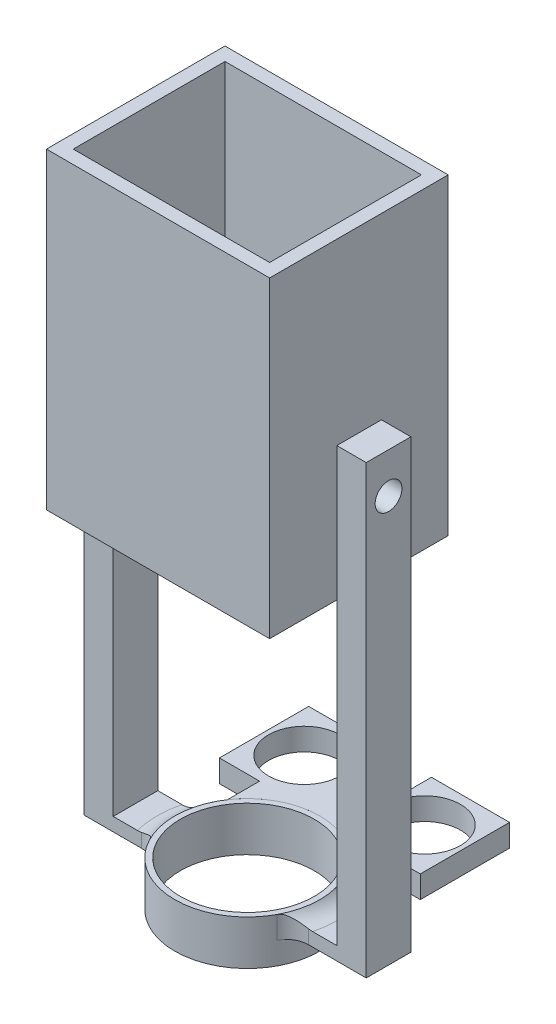
from build123d import *

# Parameters (mm, degrees)
CONNECTOR_SLEEVE_DEPTH        = 5
CONNECTOR_SLEEVE_DEPTH_BACK   = 5
SKETCH3_W                     = 50
SKETCH3_H                     = 40
SKETCH3_R                     = 3
MOTOR_CASING_DEPTH            = 70
SHELL4_T                      = -3
SKETCH6_R                     = 16
SKETCH6_R_2                   = 15
MOTOR_SITS_HERE_DEPTH         = 30
SKETCH2_16_W                  = 6.592135624
SKETCH2_16_H                  = 10
SLEEVE_CASING_CONNECTOR_DEPTH = 3
SKETCH2_17_W                  = 6.592135624
SKETCH2_17_H                  = 10
SLEEVE_CASING_ARMS_DEPTH      = 100
SKETCH2_10_R                  = 8
SENSOR_HOLDER_DEPTH           = 5
FILLET2_R                     = 5
CUT_EXTRUDE5_DEPTH            = 124.769792437
CUT_EXTRUDE5_DEPTH_BACK       = 124.769792437
SKETCH8_R                     = 3


with BuildPart() as part:
    # Sketch2 → Connector sleeve (new, two sides: drawn at the far end of the back side and taken through both)
    with BuildSketch(Plane(origin=(0, 0, 0), x_dir=(1, 0, 0), z_dir=(0, 1, 0)).offset(-CONNECTOR_SLEEVE_DEPTH_BACK)):
        with BuildLine():
            Line((-14.142135624, -5), (-15.461646096, -5))
            ThreePointArc((-15.461646096, -5), (0, -16.25), (15.461646096, -5))
            Line((15.461646096, -5), (14.142135624, -5))
            ThreePointArc((14.142135624, -5), (0, -15), (-14.142135624, -5))
        make_face()
        with BuildLine():
            ThreePointArc((-13.5, 9.045026258), (-14.62138145, 7.090677295), (-15.461646096, 5))
            Line((-15.461646096, 5), (-14.142135624, 5))
            ThreePointArc((-14.142135624, 5), (0, 15), (14.142135624, 5))
            Line((14.142135624, 5), (15.461646096, 5))
            ThreePointArc((15.461646096, 5), (14.62138145, 7.090677295), (13.5, 9.045026258))
            ThreePointArc((13.5, 9.045026258), (7.651170607, 14.336041586), (0, 16.25))
            ThreePointArc((0, 16.25), (-7.651170607, 14.336041586), (-13.5, 9.045026258))
        make_face()
        with BuildLine():
            Line((15.461646096, 5), (14.142135624, 5))
            ThreePointArc((14.142135624, 5), (14.783978395, 2.536529681), (15, 0))
            ThreePointArc((15, 0), (14.783978395, -2.536529681), (14.142135624, -5))
            Line((14.142135624, -5), (15.461646096, -5))
            ThreePointArc((15.461646096, -5), (16.051701609, -2.530884326), (16.25, 0))
            ThreePointArc((16.25, 0), (16.051701609, 2.530884326), (15.461646096, 5))
        make_face()
        with BuildLine():
            Line((-14.142135624, 5), (-15.461646096, 5))
            ThreePointArc((-15.461646096, 5), (-16.25, 0), (-15.461646096, -5))
            Line((-15.461646096, -5), (-14.142135624, -5))
            ThreePointArc((-14.142135624, -5), (-15, 0), (-14.142135624, 5))
        make_face()
    extrude(amount=CONNECTOR_SLEEVE_DEPTH + CONNECTOR_SLEEVE_DEPTH_BACK)

    # Sketch2<16> → Sleeve-casing connector (add)
    with BuildSketch(Plane(origin=(0, 0, 0), x_dir=(1, 0, 0), z_dir=(0, 1, 0))):
        with BuildLine():
            Line((-15.461646096, 5), (-25.05, 5))
            Line((-25.05, 5), (-25.05, -5))
            Line((-25.05, -5), (-15.461646096, -5))
            ThreePointArc((-15.461646096, -5), (-16.25, 0), (-15.461646096, 5))
        make_face()
        with Locations((-28.346067812, 0)):
            Rectangle(SKETCH2_16_W, SKETCH2_16_H)
        with BuildLine():
            ThreePointArc((16.25, 0), (16.051701609, -2.530884326), (15.461646096, -5))
            Line((15.461646096, -5), (25.05, -5))
            Line((25.05, -5), (25.05, 5))
            Line((25.05, 5), (15.461646096, 5))
            ThreePointArc((15.461646096, 5), (16.051701609, 2.530884326), (16.25, 0))
        make_face()
        with Locations((28.346067812, 0)):
            Rectangle(SKETCH2_16_W, SKETCH2_16_H)
    extrude(amount=SLEEVE_CASING_CONNECTOR_DEPTH)

    # Sketch2<17> → Sleeve-casing arms (add)
    with BuildSketch(Plane(origin=(0, 0, 0), x_dir=(1, 0, 0), z_dir=(0, 1, 0))):
        with Locations((-28.346067812, 0)):
            Rectangle(SKETCH2_17_W, SKETCH2_17_H)
        with Locations((28.346067812, 0)):
            Rectangle(SKETCH2_17_W, SKETCH2_17_H)
    extrude(amount=SLEEVE_CASING_ARMS_DEPTH)

    # Fillet2
    # the kernel refuses this fillet: 5 mm, written as the material it adds along each edge
    with BuildSketch(Plane(origin=(0, 3, 0), x_dir=(-0.5992835092298462, 0, 0.8005368670868074), z_dir=(0.8005368670868074, 0, 0.5992835092298462))) as fillet2_piece_1_section:
        with BuildLine():
            CenterArc((20.25, -5), FILLET2_R, 90, 53.130102354)
            Line((20.25, 0), (20.25, 0.1))
            Line((20.25, 0.1), (16.25, 0.1))
            Line((16.25, 0.1), (16.15, 0))
            ThreePointArc((16.15, 0), (16.15, -1), (16.17, -1.94))
            Line((16.17, -1.94), (16.25, -2))
        make_face()
    fillet2_piece_1 = revolve(axis=Axis((0, 3, 0), (0, -1, 0)), revolution_arc=106.362800019, mode=Mode.PRIVATE)
    fillet2_piece_1 = split(fillet2_piece_1, bisect_by=Plane(origin=(-17.030163823, 3.512375165, -5), z_dir=(0, 0, 1)), keep=Keep.TOP, mode=Mode.PRIVATE)
    fillet2_piece_1 = split(fillet2_piece_1, bisect_by=Plane(origin=(-17.030163823, 3.512375165, 5), z_dir=(0, 0, -1)), keep=Keep.TOP, mode=Mode.PRIVATE)
    add(fillet2_piece_1)
    with BuildSketch(Plane(origin=(-15.461646096, 0, 5), x_dir=(0.3906724879832055, 0, 0.9205297426661521), z_dir=(0, 1, 0)), Plane(origin=(15.461646096, 0, -5), x_dir=(-0.39067248798317566, 0, -0.9205297426661648), z_dir=(0, 1, 0))) as fillet2_piece_2:
        with BuildLine():
            CenterArc((3.317979312, -4.980390013), FILLET2_R, 95.076136898, 61.927513064)
            Line((-1.284669401, -3.027027573), (-1.376722375, -2.987960324))
            Line((-1.376722375, -2.987960324), (-0.092052974, 0.039067249))
            Line((-0.092052974, 0.039067249), (0.008847945, 0.0996078))
            ThreePointArc((0.008847945, 0.0996078), (1.437791035, 0.036267542), (2.866734126, 0.0996078))
            Line((2.866734126, 0.0996078), (2.875582071, 0))
        make_face()
    extrude(amount=3)
    with BuildSketch(Plane(origin=(-15.461646096, 0, -5), x_dir=(0.3906724879831855, 0, -0.9205297426661605), z_dir=(0, 1, 0)), Plane(origin=(15.461646096, 0, 5), x_dir=(-0.3906724879831673, 0, 0.9205297426661683), z_dir=(0, 1, 0))) as fillet2_piece_3:
        with BuildLine():
            CenterArc((3.317979312, 4.980390013), FILLET2_R, 202.996350038, 61.927513064)
            Line((-1.284669401, 3.027027573), (-1.376722375, 2.987960324))
            Line((-1.376722375, 2.987960324), (-0.092052974, -0.039067249))
            Line((-0.092052974, -0.039067249), (0.008847945, -0.0996078))
            ThreePointArc((0.008847945, -0.0996078), (1.437791035, -0.036267542), (2.866734126, -0.0996078))
            Line((2.866734126, -0.0996078), (2.875582071, 0))
        make_face()
    extrude(amount=3)
    with BuildSketch(Plane(origin=(0, 3, 0), x_dir=(0.5992835092298779, 0, 0.8005368670867836), z_dir=(-0.8005368670867836, 0, 0.5992835092298779))) as fillet2_piece_4_section:
        with BuildLine():
            CenterArc((20.25, 5), FILLET2_R, 216.869897646, 53.130102354)
            Line((20.25, 0), (20.25, -0.1))
            Line((20.25, -0.1), (16.25, -0.1))
            Line((16.25, -0.1), (16.15, 0))
            ThreePointArc((16.15, 0), (16.15, 1), (16.17, 1.94))
            Line((16.17, 1.94), (16.25, 2))
        make_face()
    fillet2_piece_4 = revolve(axis=Axis((0, 3, 0), (0, 1, 0)), revolution_arc=106.362800019, mode=Mode.PRIVATE)
    fillet2_piece_4 = split(fillet2_piece_4, bisect_by=Plane(origin=(17.030163823, 3.512375165, 5), z_dir=(0, 0, -1)), keep=Keep.TOP, mode=Mode.PRIVATE)
    fillet2_piece_4 = split(fillet2_piece_4, bisect_by=Plane(origin=(17.030163823, 3.512375165, -5), z_dir=(0, 0, 1)), keep=Keep.TOP, mode=Mode.PRIVATE)
    add(fillet2_piece_4)
    with BuildSketch(Plane(origin=(0, 3, 0), x_dir=(-0.5992835092298462, 0, 0.8005368670868074), z_dir=(0.8005368670868074, 0, 0.5992835092298462))) as fillet2_piece_5a_section:
        with BuildLine():
            CenterArc((20.25, -5), FILLET2_R, 90, 53.130102354)
            Line((20.25, 0), (20.25, 0.1))
            Line((20.25, 0.1), (16.25, 0.1))
            Line((16.25, 0.1), (16.15, 0))
            ThreePointArc((16.15, 0), (16.15, -1), (16.17, -1.94))
            Line((16.17, -1.94), (16.25, -2))
        make_face()
    fillet2_piece_5a = revolve(axis=Axis((0, 3, 0), (0, -1, 0)), revolution_arc=106.362800019, mode=Mode.PRIVATE)
    fillet2_piece_5a = split(fillet2_piece_5a, bisect_by=Plane(origin=(-13.980724367, 3.489518258, 5), z_dir=(0, 0, 1)), keep=Keep.TOP, mode=Mode.PRIVATE)
    with BuildSketch(Plane(origin=(-15.461646096, 0, 5), x_dir=(0.3906724879832055, 0, 0.9205297426661521), z_dir=(0, 1, 0))) as fillet2_piece_5b_section:
        with BuildLine():
            CenterArc((3.317979312, -4.980390013), FILLET2_R, 95.076136898, 61.927513064)
            Line((-1.284669401, -3.027027573), (-1.376722375, -2.987960324))
            Line((-1.376722375, -2.987960324), (-0.092052974, 0.039067249))
            Line((-0.092052974, 0.039067249), (0.008847945, 0.0996078))
            ThreePointArc((0.008847945, 0.0996078), (1.437791035, 0.036267542), (2.866734126, 0.0996078))
            Line((2.866734126, 0.0996078), (2.875582071, 0))
        make_face()
    fillet2_piece_5b = extrude(amount=11.22088476, mode=Mode.PRIVATE)
    fillet2_piece_5b = split(fillet2_piece_5b, bisect_by=Plane(origin=(-15.995215442, 5, 5.576522303), z_dir=(0, -1, 0)), keep=Keep.TOP, mode=Mode.PRIVATE)
    fillet2_piece_5b = split(fillet2_piece_5b, bisect_by=Plane(origin=(-15.995215442, 3, 5.576522303), z_dir=(0, 1, 0)), keep=Keep.TOP, mode=Mode.PRIVATE)
    fillet2_piece_5 = fillet2_piece_5a & fillet2_piece_5b
    add(fillet2_piece_5)
    with BuildSketch(Plane(origin=(-15.461646096, 0, -5), x_dir=(0.3906724879831855, 0, -0.9205297426661605), z_dir=(0, 1, 0))) as fillet2_piece_6a_section:
        with BuildLine():
            CenterArc((3.317979312, 4.980390013), FILLET2_R, 202.996350038, 61.927513064)
            Line((-1.284669401, 3.027027573), (-1.376722375, 2.987960324))
            Line((-1.376722375, 2.987960324), (-0.092052974, -0.039067249))
            Line((-0.092052974, -0.039067249), (0.008847945, -0.0996078))
            ThreePointArc((0.008847945, -0.0996078), (1.437791035, -0.036267542), (2.866734126, -0.0996078))
            Line((2.866734126, -0.0996078), (2.875582071, 0))
        make_face()
    fillet2_piece_6a = extrude(amount=11.22088476, mode=Mode.PRIVATE)
    fillet2_piece_6a = split(fillet2_piece_6a, bisect_by=Plane(origin=(-15.995215442, 5, -5.576522303), z_dir=(0, -1, 0)), keep=Keep.TOP, mode=Mode.PRIVATE)
    fillet2_piece_6a = split(fillet2_piece_6a, bisect_by=Plane(origin=(-15.995215442, 3, -5.576522303), z_dir=(0, 1, 0)), keep=Keep.TOP, mode=Mode.PRIVATE)
    with BuildSketch(Plane(origin=(0, 3, 0), x_dir=(-0.5992835092298462, 0, 0.8005368670868074), z_dir=(0.8005368670868074, 0, 0.5992835092298462))) as fillet2_piece_6b_section:
        with BuildLine():
            CenterArc((20.25, -5), FILLET2_R, 90, 53.130102354)
            Line((20.25, 0), (20.25, 0.1))
            Line((20.25, 0.1), (16.25, 0.1))
            Line((16.25, 0.1), (16.15, 0))
            ThreePointArc((16.15, 0), (16.15, -1), (16.17, -1.94))
            Line((16.17, -1.94), (16.25, -2))
        make_face()
    fillet2_piece_6b = revolve(axis=Axis((0, 3, 0), (0, -1, 0)), revolution_arc=106.362800019, mode=Mode.PRIVATE)
    fillet2_piece_6b = split(fillet2_piece_6b, bisect_by=Plane(origin=(-13.980724067, 3.489518328, -5), z_dir=(0, 0, -1)), keep=Keep.TOP, mode=Mode.PRIVATE)
    fillet2_piece_6 = fillet2_piece_6a & fillet2_piece_6b
    add(fillet2_piece_6)
    with BuildSketch(Plane(origin=(15.461646096, 0, 5), x_dir=(-0.3906724879831673, 0, 0.9205297426661683), z_dir=(0, 1, 0))) as fillet2_piece_7a_section:
        with BuildLine():
            CenterArc((3.317979312, 4.980390013), FILLET2_R, 202.996350038, 61.927513064)
            Line((-1.284669401, 3.027027573), (-1.376722375, 2.987960324))
            Line((-1.376722375, 2.987960324), (-0.092052974, -0.039067249))
            Line((-0.092052974, -0.039067249), (0.008847945, -0.0996078))
            ThreePointArc((0.008847945, -0.0996078), (1.437791035, -0.036267542), (2.866734126, -0.0996078))
            Line((2.866734126, -0.0996078), (2.875582071, 0))
        make_face()
    fillet2_piece_7a = extrude(amount=11.22088476, mode=Mode.PRIVATE)
    fillet2_piece_7a = split(fillet2_piece_7a, bisect_by=Plane(origin=(15.995215442, 5, 5.576522303), z_dir=(0, -1, 0)), keep=Keep.TOP, mode=Mode.PRIVATE)
    fillet2_piece_7a = split(fillet2_piece_7a, bisect_by=Plane(origin=(15.995215442, 3, 5.576522303), z_dir=(0, 1, 0)), keep=Keep.TOP, mode=Mode.PRIVATE)
    with BuildSketch(Plane(origin=(0, 3, 0), x_dir=(0.5992835092298779, 0, 0.8005368670867836), z_dir=(-0.8005368670867836, 0, 0.5992835092298779))) as fillet2_piece_7b_section:
        with BuildLine():
            CenterArc((20.25, 5), FILLET2_R, 216.869897646, 53.130102354)
            Line((20.25, 0), (20.25, -0.1))
            Line((20.25, -0.1), (16.25, -0.1))
            Line((16.25, -0.1), (16.15, 0))
            ThreePointArc((16.15, 0), (16.15, 1), (16.17, 1.94))
            Line((16.17, 1.94), (16.25, 2))
        make_face()
    fillet2_piece_7b = revolve(axis=Axis((0, 3, 0), (0, 1, 0)), revolution_arc=106.362800019, mode=Mode.PRIVATE)
    fillet2_piece_7b = split(fillet2_piece_7b, bisect_by=Plane(origin=(13.980724666, 3.489518219, 5), z_dir=(0, 0, 1)), keep=Keep.TOP, mode=Mode.PRIVATE)
    fillet2_piece_7 = fillet2_piece_7a & fillet2_piece_7b
    add(fillet2_piece_7)
    with BuildSketch(Plane(origin=(0, 3, 0), x_dir=(0.5992835092298779, 0, 0.8005368670867836), z_dir=(-0.8005368670867836, 0, 0.5992835092298779))) as fillet2_piece_8a_section:
        with BuildLine():
            CenterArc((20.25, 5), FILLET2_R, 216.869897646, 53.130102354)
            Line((20.25, 0), (20.25, -0.1))
            Line((20.25, -0.1), (16.25, -0.1))
            Line((16.25, -0.1), (16.15, 0))
            ThreePointArc((16.15, 0), (16.15, 1), (16.17, 1.94))
            Line((16.17, 1.94), (16.25, 2))
        make_face()
    fillet2_piece_8a = revolve(axis=Axis((0, 3, 0), (0, 1, 0)), revolution_arc=106.362800019, mode=Mode.PRIVATE)
    fillet2_piece_8a = split(fillet2_piece_8a, bisect_by=Plane(origin=(13.980723768, 3.489518367, -5), z_dir=(0, 0, -1)), keep=Keep.TOP, mode=Mode.PRIVATE)
    with BuildSketch(Plane(origin=(15.461646096, 0, -5), x_dir=(-0.39067248798317566, 0, -0.9205297426661648), z_dir=(0, 1, 0))) as fillet2_piece_8b_section:
        with BuildLine():
            CenterArc((3.317979312, -4.980390013), FILLET2_R, 95.076136898, 61.927513064)
            Line((-1.284669401, -3.027027573), (-1.376722375, -2.987960324))
            Line((-1.376722375, -2.987960324), (-0.092052974, 0.039067249))
            Line((-0.092052974, 0.039067249), (0.008847945, 0.0996078))
            ThreePointArc((0.008847945, 0.0996078), (1.437791035, 0.036267542), (2.866734126, 0.0996078))
            Line((2.866734126, 0.0996078), (2.875582071, 0))
        make_face()
    fillet2_piece_8b = extrude(amount=11.22088476, mode=Mode.PRIVATE)
    fillet2_piece_8b = split(fillet2_piece_8b, bisect_by=Plane(origin=(15.995215442, 5, -5.576522303), z_dir=(0, -1, 0)), keep=Keep.TOP, mode=Mode.PRIVATE)
    fillet2_piece_8b = split(fillet2_piece_8b, bisect_by=Plane(origin=(15.995215442, 3, -5.576522303), z_dir=(0, 1, 0)), keep=Keep.TOP, mode=Mode.PRIVATE)
    fillet2_piece_8 = fillet2_piece_8a & fillet2_piece_8b
    add(fillet2_piece_8)

    # Sketch8 → Cut-Extrude5 (cut, two sides: drawn at the far end of the back side and taken through both)
    with BuildSketch(Plane.ZY.offset(31.642135624).offset(-CUT_EXTRUDE5_DEPTH_BACK)):
        with Locations((0, 91)):
            Circle(SKETCH8_R)
    extrude(amount=CUT_EXTRUDE5_DEPTH + CUT_EXTRUDE5_DEPTH_BACK, mode=Mode.SUBTRACT)


with BuildPart() as body_2:
    # Sketch3 → Motor casing (new body)
    with BuildSketch(Plane(origin=(0, 30, 0), x_dir=(1, 0, 0), z_dir=(0, 1, 0))):
        Rectangle(SKETCH3_W, SKETCH3_H)
        with Locations(Location((0, 0, 0), (0, 0, 270))):
            Circle(SKETCH3_R, mode=Mode.SUBTRACT)
    extrude(amount=MOTOR_CASING_DEPTH)

    # Shell4
    shell4_openings = [body_2.faces().sort_by_distance(p)[0] for p in [
        (0, 100, -19.359687576),
        (0, 65, -3),
    ]]
    offset(amount=SHELL4_T, openings=shell4_openings, kind=Kind.INTERSECTION)

    # Sketch6 → Motor sits here (add)
    with BuildSketch(Plane(origin=(0, 33, 0), x_dir=(1, 0, 0), z_dir=(0, 1, 0))):
        with Locations(Location((0, 0, 0), (0, 0, 270))):
            Circle(SKETCH6_R)
        with Locations(Location((0, 0, 0), (0, 0, 270))):
            Circle(SKETCH6_R_2, mode=Mode.SUBTRACT)
    extrude(amount=MOTOR_SITS_HERE_DEPTH)


with BuildPart() as body_3:
    # Sketch2<10> → Sensor holder (new body)
    # profile 1 of 3: a face of its own
    with BuildSketch(Plane(origin=(0, 0, 0), x_dir=(1, 0, 0), z_dir=(0, 1, 0))):
        Polygon((5, 31.25), (5, 36.25), (22.5, 36.25), (22.5, 16.25), (0, 16.25), (-22.5, 16.25), (-22.5, 36.25), (-5, 36.25), (-5, 31.25), align=None)
        with Locations(Location((13.5, 26.25, 0), (0, 0, 270))):
            Circle(SKETCH2_10_R, mode=Mode.SUBTRACT)
        with Locations(Location((-13.5, 26.25, 0), (0, 0, 270))):
            Circle(SKETCH2_10_R, mode=Mode.SUBTRACT)
    # profile 2 of 3: a face of its own
    with BuildSketch(Plane(origin=(0, 0, 0), x_dir=(1, 0, 0), z_dir=(0, 1, 0))):
        with BuildLine():
            Line((-13.5, 16.25), (-13.5, 9.045026258))
            ThreePointArc((-13.5, 9.045026258), (-7.651170607, 14.336041586), (0, 16.25))
            Line((0, 16.25), (-13.5, 16.25))
        make_face()
    # profile 3 of 3: a face of its own
    with BuildSketch(Plane(origin=(0, 0, 0), x_dir=(1, 0, 0), z_dir=(0, 1, 0))):
        with BuildLine():
            Line((13.5, 16.25), (0, 16.25))
            ThreePointArc((0, 16.25), (7.651170607, 14.336041586), (13.5, 9.045026258))
            Line((13.5, 9.045026258), (13.5, 16.25))
        make_face()
    extrude(amount=SENSOR_HOLDER_DEPTH)


with BuildPart() as body_2_1:
    # Body-Move/Copy3: moved
    add(body_2.part.moved(Location((0, 40, 0))))


solid = Compound([part.part, body_3.part, body_2_1.part])
